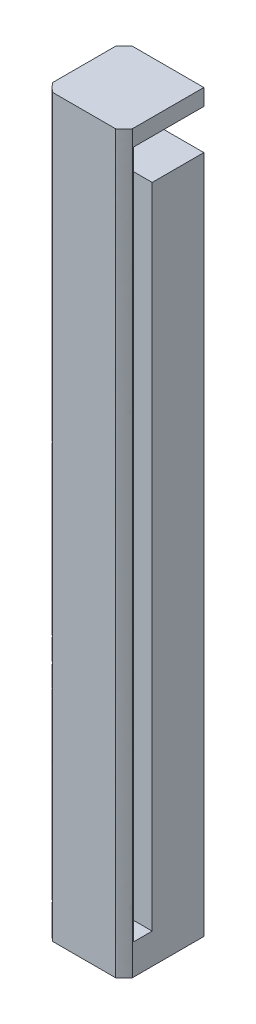
from build123d import *

# Parameters (mm, degrees)
SKETCH1_W           = 10
SKETCH1_H           = 10
BOSS_EXTRUDE1_DEPTH = 75
SKETCH3_W           = 7.5
SKETCH3_H           = 4.25
CUT_EXTRUDE1_DEPTH  = 7.5
SKETCH4_W           = 2
SKETCH4_H           = 5.5
CUT_EXTRUDE2_DEPTH  = 73.25
SKETCH5_W           = 10
SKETCH5_H           = 10
BOSS_EXTRUDE2_DEPTH = 3.25
BOSS_EXTRUDE3_REACH = 78.322
SKETCH6_W           = 1
SKETCH6_H           = 1.9
SKETCH6_H_2         = 2
SKETCH7_R           = 2.175
CUT_EXTRUDE3_DEPTH  = 3
SKETCH8_W           = 8.5
SKETCH8_H           = 1.5
CUT_EXTRUDE4_DEPTH  = 80.517686712
FILLET1_SIZE        = 0.9


with BuildPart() as part:
    # Sketch1 → Boss-Extrude1 (new body)
    with BuildSketch(Plane(origin=(0, 0, 0), x_dir=(1, 0, 0), z_dir=(0, 1, 0))):
        with Locations((5, 5)):
            Rectangle(SKETCH1_W, SKETCH1_H)
    extrude(amount=BOSS_EXTRUDE1_DEPTH)

    # Sketch3 → Cut-Extrude1 (cut)
    with BuildSketch(Plane(origin=(0, 0, -10), x_dir=(-1, 0, 0), z_dir=(0, 0, -1))):
        with Locations((-6.25, 71.125)):
            Rectangle(SKETCH3_W, SKETCH3_H)
    extrude(amount=-CUT_EXTRUDE1_DEPTH, mode=Mode.SUBTRACT)

    # Sketch4 → Cut-Extrude2 (cut)
    with BuildSketch(Plane.XZ):
        Polygon((10, -2.5), (2.5, -2.5), (2.5, -4.5), (4.5, -4.5), (10, -4.5), align=None)
        with Locations((3.5, -7.25)):
            Rectangle(SKETCH4_W, SKETCH4_H)
    extrude(amount=-CUT_EXTRUDE2_DEPTH, mode=Mode.SUBTRACT)


with BuildPart() as cut_extrude2_piece_1:
    # of the separate pieces the step leaves, piece 1, a body of its own (cut_extrude2_pieces)
    add(part.part.solids().sort_by_distance((0, 0, 0))[0])



with BuildPart() as cut_extrude2_piece_2:
    # of the separate pieces the step leaves, piece 2, a body of its own (cut_extrude2_pieces)
    add(part.part.solids().sort_by_distance((10, 0, -4.5))[0])


with BuildPart() as cut_extrude2_piece_1_1:
    add(cut_extrude2_piece_1.part)

    add(cut_extrude2_piece_2.part)  # Boss-Extrude2 merges Cut-Extrude2 piece 2
    # Sketch5 → Boss-Extrude2 (add)
    with BuildSketch(Plane.XZ):
        with Locations((5, -5)):
            Rectangle(SKETCH5_W, SKETCH5_H)
    extrude(amount=BOSS_EXTRUDE2_DEPTH)

    # Boss-Extrude3: up to this face of the body (flat: up to its plane)
    boss_extrude3_end = Plane(cut_extrude2_piece_1_1.part.faces().sort_by_distance((6.25, 73.25, -6.25))[0])
    # Sketch6 → Boss-Extrude3 (add, up to the picked face)
    with BuildSketch(Plane(origin=(0, 0, 0), x_dir=(1, 0, 0), z_dir=(0, 1, 0)), mode=Mode.PRIVATE) as boss_extrude3_sk1:
        Polygon((3.5, 4.5), (3.5, 2.5), (6.4, 2.5), (6.4, 4.5), (4.5, 4.5), align=None)
    boss_extrude3_tool1 = split(extrude(boss_extrude3_sk1.sketch, amount=BOSS_EXTRUDE3_REACH, mode=Mode.PRIVATE), bisect_by=boss_extrude3_end, keep=Keep.BOTH, mode=Mode.PRIVATE)
    # Sketch6 → Boss-Extrude3 (add, up to the picked face)
    with BuildSketch(Plane(origin=(0, 0, 0), x_dir=(1, 0, 0), z_dir=(0, 1, 0)), mode=Mode.PRIVATE) as boss_extrude3_sk2:
        with Locations((4, 5.45)):
            Rectangle(SKETCH6_W, SKETCH6_H)
    boss_extrude3_tool2 = split(extrude(boss_extrude3_sk2.sketch, amount=BOSS_EXTRUDE3_REACH, mode=Mode.PRIVATE), bisect_by=boss_extrude3_end, keep=Keep.BOTH, mode=Mode.PRIVATE)
    # Sketch6 → Boss-Extrude3 (add, up to the picked face)
    with BuildSketch(Plane(origin=(0, 0, 0), x_dir=(1, 0, 0), z_dir=(0, 1, 0)), mode=Mode.PRIVATE) as boss_extrude3_sk3:
        with Locations((3, 5.45)):
            Rectangle(SKETCH6_W, SKETCH6_H)
    boss_extrude3_tool3 = split(extrude(boss_extrude3_sk3.sketch, amount=BOSS_EXTRUDE3_REACH, mode=Mode.PRIVATE), bisect_by=boss_extrude3_end, keep=Keep.BOTH, mode=Mode.PRIVATE)
    # Sketch6 → Boss-Extrude3 (add, up to the picked face)
    with BuildSketch(Plane(origin=(0, 0, 0), x_dir=(1, 0, 0), z_dir=(0, 1, 0)), mode=Mode.PRIVATE) as boss_extrude3_sk4:
        with Locations((3, 3.5)):
            Rectangle(SKETCH6_W, SKETCH6_H_2)
    boss_extrude3_tool4 = split(extrude(boss_extrude3_sk4.sketch, amount=BOSS_EXTRUDE3_REACH, mode=Mode.PRIVATE), bisect_by=boss_extrude3_end, keep=Keep.BOTH, mode=Mode.PRIVATE)
    add(boss_extrude3_tool1.solids().sort_by(Axis((4.95, 0, -3.5), (0, 1, 0)))[0])
    add(boss_extrude3_tool2.solids().sort_by(Axis((4, 0, -5.45), (0, 1, 0)))[0])
    add(boss_extrude3_tool3.solids().sort_by(Axis((3, 0, -5.45), (0, 1, 0)))[0])
    add(boss_extrude3_tool4.solids().sort_by(Axis((3, 0, -3.5), (0, 1, 0)))[0])

    # Sketch7 → Cut-Extrude3 (cut)
    with BuildSketch(Plane.XZ.offset(3.25)):
        with Locations(Location((5, -5, 0), (0, 0, 270))):
            Circle(SKETCH7_R)
    extrude(amount=-CUT_EXTRUDE3_DEPTH, mode=Mode.SUBTRACT)

    # Sketch8 → Cut-Extrude4 (cut, through all)
    with BuildSketch(Plane(origin=(0, 75, 0), x_dir=(1, 0, 0), z_dir=(0, 1, 0))):
        Polygon((1.5, 10), (0, 10), (0, 0), (1.5, 0), (1.5, 1.5), align=None)
        with Locations((5.75, 0.75)):
            Rectangle(SKETCH8_W, SKETCH8_H)
    extrude(amount=-CUT_EXTRUDE4_DEPTH, mode=Mode.SUBTRACT)

    # Fillet1
    # a fillet whose section is not a circle: 0.9 mm, written as the material it takes off along each edge
    with BuildSketch(Plane(origin=(10, 77.25, -1.5), x_dir=(0, 0, -1), z_dir=(0, -1, 0)), Plane(origin=(1.5, 77.25, -1.5), x_dir=(1, 0, 0), z_dir=(0, -1, 0))) as fillet1_piece_1:
        with BuildLine():
            Bezier((FILLET1_SIZE, 0), (0, 0), (0, -FILLET1_SIZE), weights=[1, 0.052631579, 1])
            Line((0, -FILLET1_SIZE), (0, 0))
            Line((0, 0), (FILLET1_SIZE, 0))
        make_face()
    extrude(amount=82.75, mode=Mode.SUBTRACT)
    with BuildSketch(Plane(origin=(1.5, 77.25, -10), x_dir=(1, 0, 0), z_dir=(0, -1, 0))) as fillet1_piece_2:
        with BuildLine():
            Bezier((FILLET1_SIZE, 0), (0, 0), (0, FILLET1_SIZE), weights=[1, 0.052631579, 1])
            Line((0, FILLET1_SIZE), (0, 0))
            Line((0, 0), (FILLET1_SIZE, 0))
        make_face()
    extrude(amount=82.75, mode=Mode.SUBTRACT)


solid = cut_extrude2_piece_1_1.part
